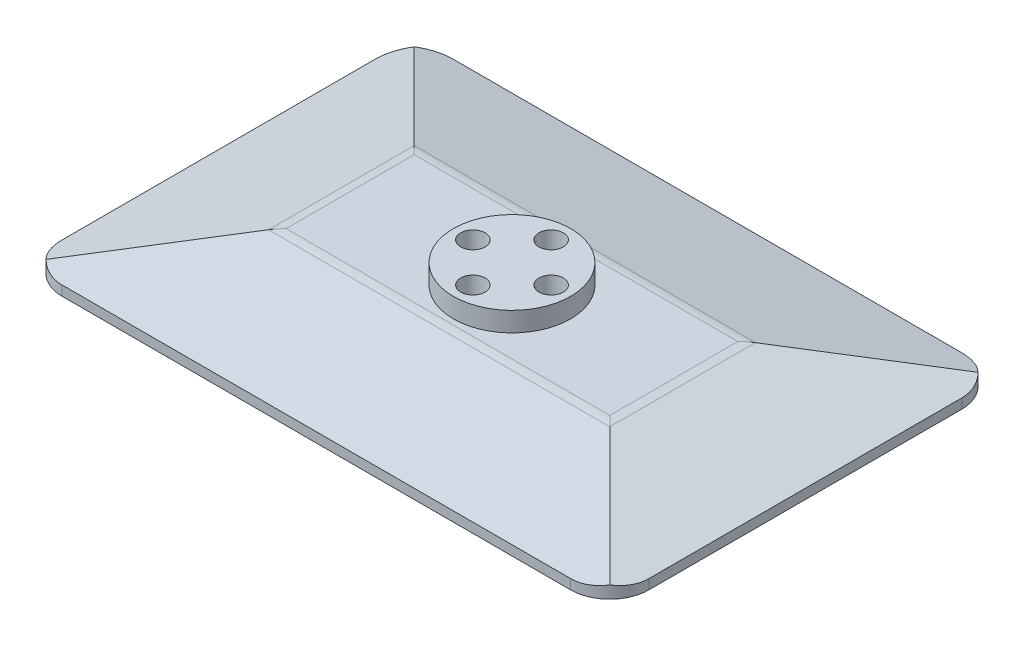
from build123d import *

# Parameters (mm, degrees)
SKETCH_1_W                    = 60
SKETCH_1_H                    = 40
EXTRUDE_1_DEPTH               = 1
SKETCH_2_W                    = 60
SKETCH_2_H                    = 40
EXTRUDE_2_DEPTH               = 3
EXTRUDE_2_TAPER               = 77
FILLET_1_R                    = 4
SKETCH_3_R                    = 6
EXTRUDE_3_DEPTH               = 2
FILLET_2_R                    = 4
SKETCH_4_R                    = 1.25
CUT_EXTRUDE_1_DEPTH           = 3
CUT_EXTRUDE_1_DRAFT           = -5
CUT_EXTRUDE_1_PROFILE_2_DEPTH = 3
CUT_EXTRUDE_1_PROFILE_2_DRAFT = -5
CUT_EXTRUDE_1_PROFILE_3_DEPTH = 3
CUT_EXTRUDE_1_PROFILE_3_DRAFT = -5
CUT_EXTRUDE_1_PROFILE_4_DEPTH = 3
CUT_EXTRUDE_1_PROFILE_4_DRAFT = -5


with BuildPart() as part:
    # 草图1 → 凸台-拉伸1 (new body)
    with BuildSketch(Plane(origin=(0, 0, 0), x_dir=(1, 0, 0), z_dir=(0, 1, 0))):
        with Locations((5.975375352, -10.213749482)):
            Rectangle(SKETCH_1_W, SKETCH_1_H)
    extrude(amount=EXTRUDE_1_DEPTH)

    # 草图2 → 凸台-拉伸2 (add)
    with BuildSketch(Plane(origin=(0, 1, 0), x_dir=(1, 0, 0), z_dir=(0, 1, 0))):
        with Locations((5.975375352, -10.213749482)):
            Rectangle(SKETCH_2_W, SKETCH_2_H)
    extrude(amount=EXTRUDE_2_DEPTH, taper=EXTRUDE_2_TAPER)

    # 圆角1
    fillet_1_edges = [part.edges().sort_by_distance(p)[0] for p in [
        (-24.024624648, 0.5, -9.786250518),
        (35.975375352, 0.5, -9.786250518),
        (35.975375352, 0.5, 30.213749482),
        (-24.024624648, 0.5, 30.213749482),
    ]]
    fillet(fillet_1_edges, radius=FILLET_1_R)

    # 草图3 → 凸台-拉伸3 (add)
    with BuildSketch(Plane(origin=(0, 4, 0), x_dir=(1, 0, 0), z_dir=(0, 1, 0))):
        with Locations((5.975375352, -10.213749482)):
            Circle(SKETCH_3_R)
    extrude(amount=EXTRUDE_3_DEPTH)

    # 圆角2
    fillet_2_edges = [part.edges().sort_by_distance(p)[0] for p in [
        (22.980947729, 4, 10.213749482),
        (5.975375352, 4, 3.208177105),
        (-11.030197026, 4, 10.213749482),
        (5.975375352, 4, 17.219321859),
    ]]
    fillet(fillet_2_edges, radius=FILLET_2_R)


with BuildPart() as cut_extrude_1_tool:
    # 草图4 → 切除-拉伸1 (with draft: the straight prism first)
    with BuildSketch(Plane(origin=(0, 6, 0), x_dir=(1, 0, 0), z_dir=(0, 1, 0))):
        with Locations((1.975375352, -10.213749482)):
            Circle(SKETCH_4_R)
    extrude(amount=-CUT_EXTRUDE_1_DEPTH)
    # 切除-拉伸1: the draft: its side faces are tilted about the plane it starts from
    cut_extrude_1_sides = [cut_extrude_1_tool.faces().sort_by_distance(p)[0] for p in [
        (0.725375352, 4.5, 10.213749482),
    ]]
    draft(cut_extrude_1_sides, Plane(origin=(0, 6, 0), x_dir=(1, 0, 0), z_dir=(0, 1, 0)), CUT_EXTRUDE_1_DRAFT)


with BuildPart() as part_1:
    add(part.part)

    # 切除-拉伸1: cut by cut_extrude_1_tool
    add(cut_extrude_1_tool.part, mode=Mode.SUBTRACT)


with BuildPart() as cut_extrude_1_profile_2_tool:
    # 草图4 → 切除-拉伸1 profile 2 (with draft: the straight prism first)
    with BuildSketch(Plane(origin=(0, 6, 0), x_dir=(1, 0, 0), z_dir=(0, 1, 0))):
        with Locations((5.975375352, -6.213749482)):
            Circle(SKETCH_4_R)
    extrude(amount=-CUT_EXTRUDE_1_PROFILE_2_DEPTH)
    # 切除-拉伸1 profile 2: the draft: its side faces are tilted about the plane it starts from
    cut_extrude_1_profile_2_sides = [cut_extrude_1_profile_2_tool.faces().sort_by_distance(p)[0] for p in [
        (4.725375352, 4.5, 6.213749482),
    ]]
    draft(cut_extrude_1_profile_2_sides, Plane(origin=(0, 6, 0), x_dir=(1, 0, 0), z_dir=(0, 1, 0)), CUT_EXTRUDE_1_PROFILE_2_DRAFT)


with BuildPart() as part_2:
    add(part_1.part)

    # 切除-拉伸1 profile 2: cut by cut_extrude_1_profile_2_tool
    add(cut_extrude_1_profile_2_tool.part, mode=Mode.SUBTRACT)


with BuildPart() as cut_extrude_1_profile_3_tool:
    # 草图4 → 切除-拉伸1 profile 3 (with draft: the straight prism first)
    with BuildSketch(Plane(origin=(0, 6, 0), x_dir=(1, 0, 0), z_dir=(0, 1, 0))):
        with Locations((9.975375352, -10.213749482)):
            Circle(SKETCH_4_R)
    extrude(amount=-CUT_EXTRUDE_1_PROFILE_3_DEPTH)
    # 切除-拉伸1 profile 3: the draft: its side faces are tilted about the plane it starts from
    cut_extrude_1_profile_3_sides = [cut_extrude_1_profile_3_tool.faces().sort_by_distance(p)[0] for p in [
        (8.725375352, 4.5, 10.213749482),
    ]]
    draft(cut_extrude_1_profile_3_sides, Plane(origin=(0, 6, 0), x_dir=(1, 0, 0), z_dir=(0, 1, 0)), CUT_EXTRUDE_1_PROFILE_3_DRAFT)


with BuildPart() as part_3:
    add(part_2.part)

    # 切除-拉伸1 profile 3: cut by cut_extrude_1_profile_3_tool
    add(cut_extrude_1_profile_3_tool.part, mode=Mode.SUBTRACT)


with BuildPart() as cut_extrude_1_profile_4_tool:
    # 草图4 → 切除-拉伸1 profile 4 (with draft: the straight prism first)
    with BuildSketch(Plane(origin=(0, 6, 0), x_dir=(1, 0, 0), z_dir=(0, 1, 0))):
        with Locations((5.975375352, -14.213749482)):
            Circle(SKETCH_4_R)
    extrude(amount=-CUT_EXTRUDE_1_PROFILE_4_DEPTH)
    # 切除-拉伸1 profile 4: the draft: its side faces are tilted about the plane it starts from
    cut_extrude_1_profile_4_sides = [cut_extrude_1_profile_4_tool.faces().sort_by_distance(p)[0] for p in [
        (4.725375352, 4.5, 14.213749482),
    ]]
    draft(cut_extrude_1_profile_4_sides, Plane(origin=(0, 6, 0), x_dir=(1, 0, 0), z_dir=(0, 1, 0)), CUT_EXTRUDE_1_PROFILE_4_DRAFT)


with BuildPart() as part_4:
    add(part_3.part)

    # 切除-拉伸1 profile 4: cut by cut_extrude_1_profile_4_tool
    add(cut_extrude_1_profile_4_tool.part, mode=Mode.SUBTRACT)


solid = part_4.part
